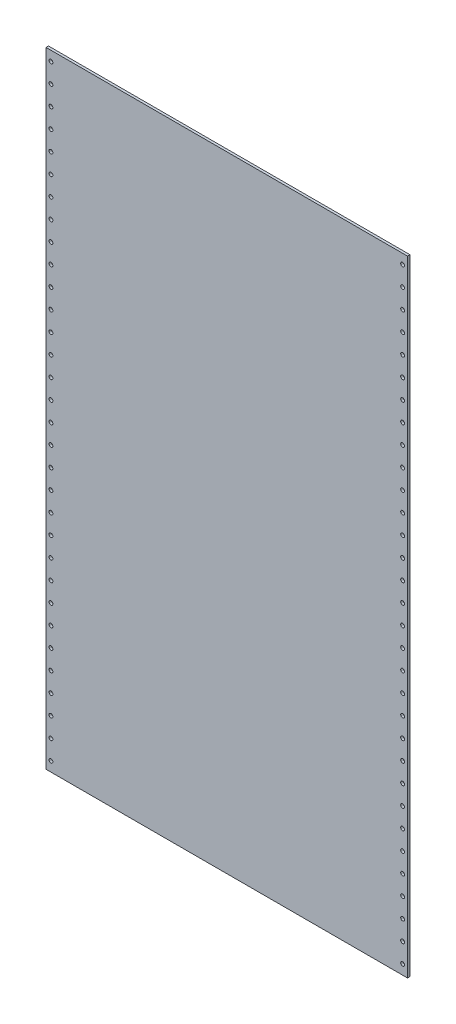
from build123d import *

# Parameters (mm, degrees)
SKETCH1_W           = 469.9
SKETCH1_H           = 812.8
SKETCH1_R           = 2.5
BOSS_EXTRUDE1_DEPTH = 3.175


with BuildPart() as part:
    # Sketch1 → Boss-Extrude1 (new body)
    with BuildSketch(Plane(origin=(0, 0, -1.5875), x_dir=(-1, 0, 0), z_dir=(0, 0, -1))):
        Rectangle(SKETCH1_W, SKETCH1_H)
        with Locations((-228.6, 393.7)):
            Circle(SKETCH1_R, mode=Mode.SUBTRACT)
        with Locations((-228.6, 368.3)):
            Circle(SKETCH1_R, mode=Mode.SUBTRACT)
        with Locations((-228.6, 342.9)):
            Circle(SKETCH1_R, mode=Mode.SUBTRACT)
        with Locations((-228.6, 317.5)):
            Circle(SKETCH1_R, mode=Mode.SUBTRACT)
        with Locations((-228.6, 292.1)):
            Circle(SKETCH1_R, mode=Mode.SUBTRACT)
        with Locations((-228.6, 266.7)):
            Circle(SKETCH1_R, mode=Mode.SUBTRACT)
        with Locations((-228.6, 241.3)):
            Circle(SKETCH1_R, mode=Mode.SUBTRACT)
        with Locations((-228.6, 215.9)):
            Circle(SKETCH1_R, mode=Mode.SUBTRACT)
        with Locations((-228.6, 190.5)):
            Circle(SKETCH1_R, mode=Mode.SUBTRACT)
        with Locations((-228.6, 165.1)):
            Circle(SKETCH1_R, mode=Mode.SUBTRACT)
        with Locations((-228.6, 139.7)):
            Circle(SKETCH1_R, mode=Mode.SUBTRACT)
        with Locations((-228.6, 114.3)):
            Circle(SKETCH1_R, mode=Mode.SUBTRACT)
        with Locations((-228.6, 88.9)):
            Circle(SKETCH1_R, mode=Mode.SUBTRACT)
        with Locations((-228.6, 63.5)):
            Circle(SKETCH1_R, mode=Mode.SUBTRACT)
        with Locations((-228.6, 38.1)):
            Circle(SKETCH1_R, mode=Mode.SUBTRACT)
        with Locations((-228.6, 12.7)):
            Circle(SKETCH1_R, mode=Mode.SUBTRACT)
        with Locations((-228.6, -12.7)):
            Circle(SKETCH1_R, mode=Mode.SUBTRACT)
        with Locations((-228.6, -38.1)):
            Circle(SKETCH1_R, mode=Mode.SUBTRACT)
        with Locations((-228.6, -63.5)):
            Circle(SKETCH1_R, mode=Mode.SUBTRACT)
        with Locations((-228.6, -88.9)):
            Circle(SKETCH1_R, mode=Mode.SUBTRACT)
        with Locations((-228.6, -114.3)):
            Circle(SKETCH1_R, mode=Mode.SUBTRACT)
        with Locations((-228.6, -139.7)):
            Circle(SKETCH1_R, mode=Mode.SUBTRACT)
        with Locations((-228.6, -165.1)):
            Circle(SKETCH1_R, mode=Mode.SUBTRACT)
        with Locations((-228.6, -190.5)):
            Circle(SKETCH1_R, mode=Mode.SUBTRACT)
        with Locations((-228.6, -215.9)):
            Circle(SKETCH1_R, mode=Mode.SUBTRACT)
        with Locations((-228.6, -241.3)):
            Circle(SKETCH1_R, mode=Mode.SUBTRACT)
        with Locations((-228.6, -266.7)):
            Circle(SKETCH1_R, mode=Mode.SUBTRACT)
        with Locations((-228.6, -292.1)):
            Circle(SKETCH1_R, mode=Mode.SUBTRACT)
        with Locations((-228.6, -317.5)):
            Circle(SKETCH1_R, mode=Mode.SUBTRACT)
        with Locations((-228.6, -342.9)):
            Circle(SKETCH1_R, mode=Mode.SUBTRACT)
        with Locations((-228.6, -368.3)):
            Circle(SKETCH1_R, mode=Mode.SUBTRACT)
        with Locations((-228.6, -393.7)):
            Circle(SKETCH1_R, mode=Mode.SUBTRACT)
        with Locations((228.6, 393.7)):
            Circle(SKETCH1_R, mode=Mode.SUBTRACT)
        with Locations((228.6, 368.3)):
            Circle(SKETCH1_R, mode=Mode.SUBTRACT)
        with Locations((228.6, 342.9)):
            Circle(SKETCH1_R, mode=Mode.SUBTRACT)
        with Locations((228.6, 317.5)):
            Circle(SKETCH1_R, mode=Mode.SUBTRACT)
        with Locations((228.6, 292.1)):
            Circle(SKETCH1_R, mode=Mode.SUBTRACT)
        with Locations((228.6, 266.7)):
            Circle(SKETCH1_R, mode=Mode.SUBTRACT)
        with Locations((228.6, 241.3)):
            Circle(SKETCH1_R, mode=Mode.SUBTRACT)
        with Locations((228.6, 215.9)):
            Circle(SKETCH1_R, mode=Mode.SUBTRACT)
        with Locations((228.6, 190.5)):
            Circle(SKETCH1_R, mode=Mode.SUBTRACT)
        with Locations((228.6, 165.1)):
            Circle(SKETCH1_R, mode=Mode.SUBTRACT)
        with Locations((228.6, 139.7)):
            Circle(SKETCH1_R, mode=Mode.SUBTRACT)
        with Locations((228.6, 114.3)):
            Circle(SKETCH1_R, mode=Mode.SUBTRACT)
        with Locations((228.6, 88.9)):
            Circle(SKETCH1_R, mode=Mode.SUBTRACT)
        with Locations((228.6, 63.5)):
            Circle(SKETCH1_R, mode=Mode.SUBTRACT)
        with Locations((228.6, 38.1)):
            Circle(SKETCH1_R, mode=Mode.SUBTRACT)
        with Locations((228.6, 12.7)):
            Circle(SKETCH1_R, mode=Mode.SUBTRACT)
        with Locations((228.6, -12.7)):
            Circle(SKETCH1_R, mode=Mode.SUBTRACT)
        with Locations((228.6, -38.1)):
            Circle(SKETCH1_R, mode=Mode.SUBTRACT)
        with Locations((228.6, -63.5)):
            Circle(SKETCH1_R, mode=Mode.SUBTRACT)
        with Locations((228.6, -88.9)):
            Circle(SKETCH1_R, mode=Mode.SUBTRACT)
        with Locations((228.6, -114.3)):
            Circle(SKETCH1_R, mode=Mode.SUBTRACT)
        with Locations((228.6, -139.7)):
            Circle(SKETCH1_R, mode=Mode.SUBTRACT)
        with Locations((228.6, -165.1)):
            Circle(SKETCH1_R, mode=Mode.SUBTRACT)
        with Locations((228.6, -190.5)):
            Circle(SKETCH1_R, mode=Mode.SUBTRACT)
        with Locations((228.6, -215.9)):
            Circle(SKETCH1_R, mode=Mode.SUBTRACT)
        with Locations((228.6, -241.3)):
            Circle(SKETCH1_R, mode=Mode.SUBTRACT)
        with Locations((228.6, -266.7)):
            Circle(SKETCH1_R, mode=Mode.SUBTRACT)
        with Locations((228.6, -292.1)):
            Circle(SKETCH1_R, mode=Mode.SUBTRACT)
        with Locations((228.6, -317.5)):
            Circle(SKETCH1_R, mode=Mode.SUBTRACT)
        with Locations((228.6, -342.9)):
            Circle(SKETCH1_R, mode=Mode.SUBTRACT)
        with Locations((228.6, -368.3)):
            Circle(SKETCH1_R, mode=Mode.SUBTRACT)
        with Locations((228.6, -393.7)):
            Circle(SKETCH1_R, mode=Mode.SUBTRACT)
    extrude(amount=-BOSS_EXTRUDE1_DEPTH)


solid = part.part
